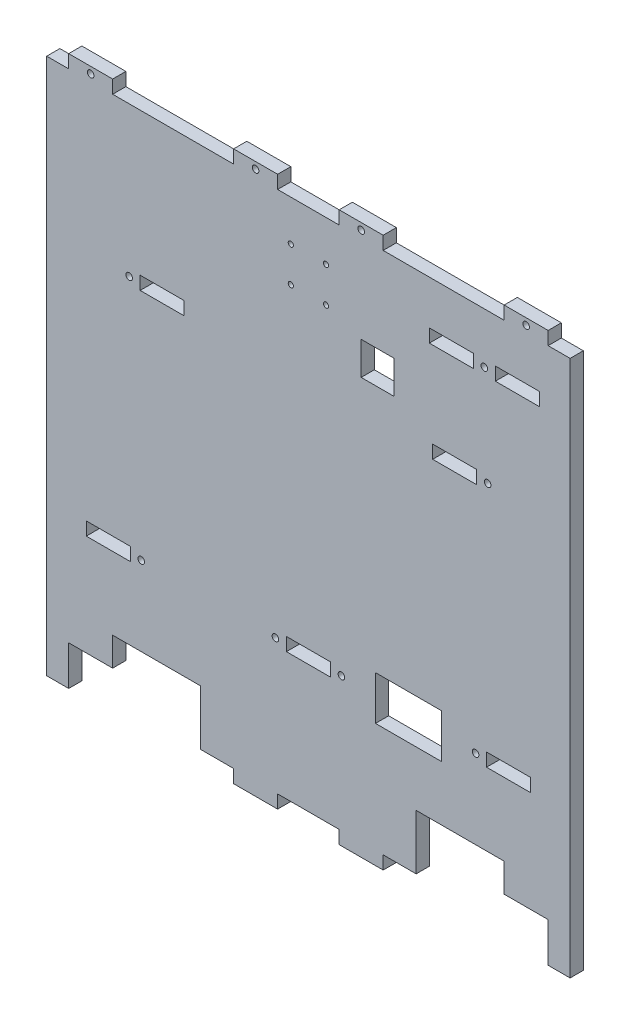
from build123d import *

# Parameters (mm, degrees)
ESQUISSE1_W             = 218
ESQUISSE1_H             = 238
ESQUISSE1_W_2           = 20
ESQUISSE1_H_2           = 6
ESQUISSE1_W_3           = 30
ESQUISSE1_H_3           = 20
ESQUISSE1_W_4           = 15
ESQUISSE1_H_4           = 15
BOSS_EXTRU_1_DEPTH      = 6
ESQUISSE2_W             = 40
ESQUISSE2_H             = 25
ENL_V_MAT_EXTRU_1_DEPTH = 6
ESQUISSE3_W             = 20
ESQUISSE3_H             = 6
BOSS_EXTRU_3_DEPTH      = 6
ESQUISSE4_R             = 1.5
ENL_V_MAT_EXTRU_2_DEPTH = 6
ESQUISSE5_W             = 10
ESQUISSE5_H             = 244
BOSS_EXTRU_4_DEPTH      = 6
ESQUISSE6_W             = 20
ESQUISSE6_H             = 12
ENL_V_MAT_EXTRU_3_DEPTH = 6
ESQUISSE7_R             = 1.175
ENL_V_MAT_EXTRU_4_DEPTH = 173.690474549


with BuildPart() as part:
    # Esquisse1 → Boss.-Extru.1 (new body)
    with BuildSketch(Plane.XY):
        Rectangle(ESQUISSE1_W, ESQUISSE1_H)
        with Locations((-91, -58)):
            Rectangle(ESQUISSE1_W_2, ESQUISSE1_H_2, mode=Mode.SUBTRACT)
        with Locations((0, -58)):
            Rectangle(ESQUISSE1_W_2, ESQUISSE1_H_2, mode=Mode.SUBTRACT)
        with Locations((91, -58)):
            Rectangle(ESQUISSE1_W_2, ESQUISSE1_H_2, mode=Mode.SUBTRACT)
        with Locations((-66.5, 51)):
            Rectangle(ESQUISSE1_W_2, ESQUISSE1_H_2, mode=Mode.SUBTRACT)
        with Locations((66.5, 51)):
            Rectangle(ESQUISSE1_W_2, ESQUISSE1_H_2, mode=Mode.SUBTRACT)
        with Locations((45.5, -59)):
            Rectangle(ESQUISSE1_W_3, ESQUISSE1_H_3, mode=Mode.SUBTRACT)
        with Locations((65, 96)):
            Rectangle(ESQUISSE1_W_2, ESQUISSE1_H_2, mode=Mode.SUBTRACT)
        with Locations((95, 96)):
            Rectangle(ESQUISSE1_W_2, ESQUISSE1_H_2, mode=Mode.SUBTRACT)
        with Locations((31.5, 71.5)):
            Rectangle(ESQUISSE1_W_4, ESQUISSE1_H_4, mode=Mode.SUBTRACT)
    extrude(amount=BOSS_EXTRU_1_DEPTH)

    # Esquisse2 → Enlèv. mat.-Extru.1 (cut)
    with BuildSketch(Plane.XY.offset(6)):
        with Locations((-69, -106.5)):
            Rectangle(ESQUISSE2_W, ESQUISSE2_H)
        with Locations((69, -106.5)):
            Rectangle(ESQUISSE2_W, ESQUISSE2_H)
    extrude(amount=-ENL_V_MAT_EXTRU_1_DEPTH, mode=Mode.SUBTRACT)

    # Esquisse3 → Boss.-Extru.3 (add)
    with BuildSketch(Plane.XY.offset(6)):
        with Locations((-24, -122)):
            Rectangle(ESQUISSE3_W, ESQUISSE3_H)
        with Locations((24, -122)):
            Rectangle(ESQUISSE3_W, ESQUISSE3_H)
        with Locations((24, 122)):
            Rectangle(ESQUISSE3_W, ESQUISSE3_H)
        with Locations((99, 122)):
            Rectangle(ESQUISSE3_W, ESQUISSE3_H)
        with Locations((-24, 122)):
            Rectangle(ESQUISSE3_W, ESQUISSE3_H)
        with Locations((-99, 122)):
            Rectangle(ESQUISSE3_W, ESQUISSE3_H)
    extrude(amount=-BOSS_EXTRU_3_DEPTH)

    # Esquisse4 → Enlèv. mat.-Extru.2 (cut)
    with BuildSketch(Plane.XY.offset(6)):
        with Locations((-15, -58)):
            Circle(ESQUISSE4_R)
        with Locations((-76, -58)):
            Circle(ESQUISSE4_R)
        with Locations((80, 96)):
            Circle(ESQUISSE4_R)
        with Locations((81.5, 51)):
            Circle(ESQUISSE4_R)
        with Locations((76, -58)):
            Circle(ESQUISSE4_R)
        with Locations((15, -58)):
            Circle(ESQUISSE4_R)
        with Locations((-81.5, 51)):
            Circle(ESQUISSE4_R)
        with Locations((-99, 122)):
            Circle(ESQUISSE4_R)
        with Locations((-24, 122)):
            Circle(ESQUISSE4_R)
        with Locations((24, 122)):
            Circle(ESQUISSE4_R)
        with Locations((99, 122)):
            Circle(ESQUISSE4_R)
    extrude(amount=-ENL_V_MAT_EXTRU_2_DEPTH, mode=Mode.SUBTRACT)

    # Esquisse5 → Boss.-Extru.4 (add)
    with BuildSketch(Plane.XY.offset(6)):
        with Locations((-114, -3)):
            Rectangle(ESQUISSE5_W, ESQUISSE5_H)
        with Locations((114, -3)):
            Rectangle(ESQUISSE5_W, ESQUISSE5_H)
    extrude(amount=-BOSS_EXTRU_4_DEPTH)

    # Esquisse6 → Enlèv. mat.-Extru.3 (cut)
    with BuildSketch(Plane.XY.offset(6)):
        with Locations((99, -113)):
            Rectangle(ESQUISSE6_W, ESQUISSE6_H)
        with Locations((-99, -113)):
            Rectangle(ESQUISSE6_W, ESQUISSE6_H)
    extrude(amount=-ENL_V_MAT_EXTRU_3_DEPTH, mode=Mode.SUBTRACT)

    # Esquisse7 → Enlèv. mat.-Extru.4 (cut, through all)
    with BuildSketch(Plane.XY.offset(6)):
        with Locations((-8, 100.5)):
            Circle(ESQUISSE7_R)
        with Locations((8, 100.5)):
            Circle(ESQUISSE7_R)
        with Locations((-8, 84.5)):
            Circle(ESQUISSE7_R)
        with Locations((8, 84.5)):
            Circle(ESQUISSE7_R)
    extrude(amount=-ENL_V_MAT_EXTRU_4_DEPTH, mode=Mode.SUBTRACT)


solid = part.part
